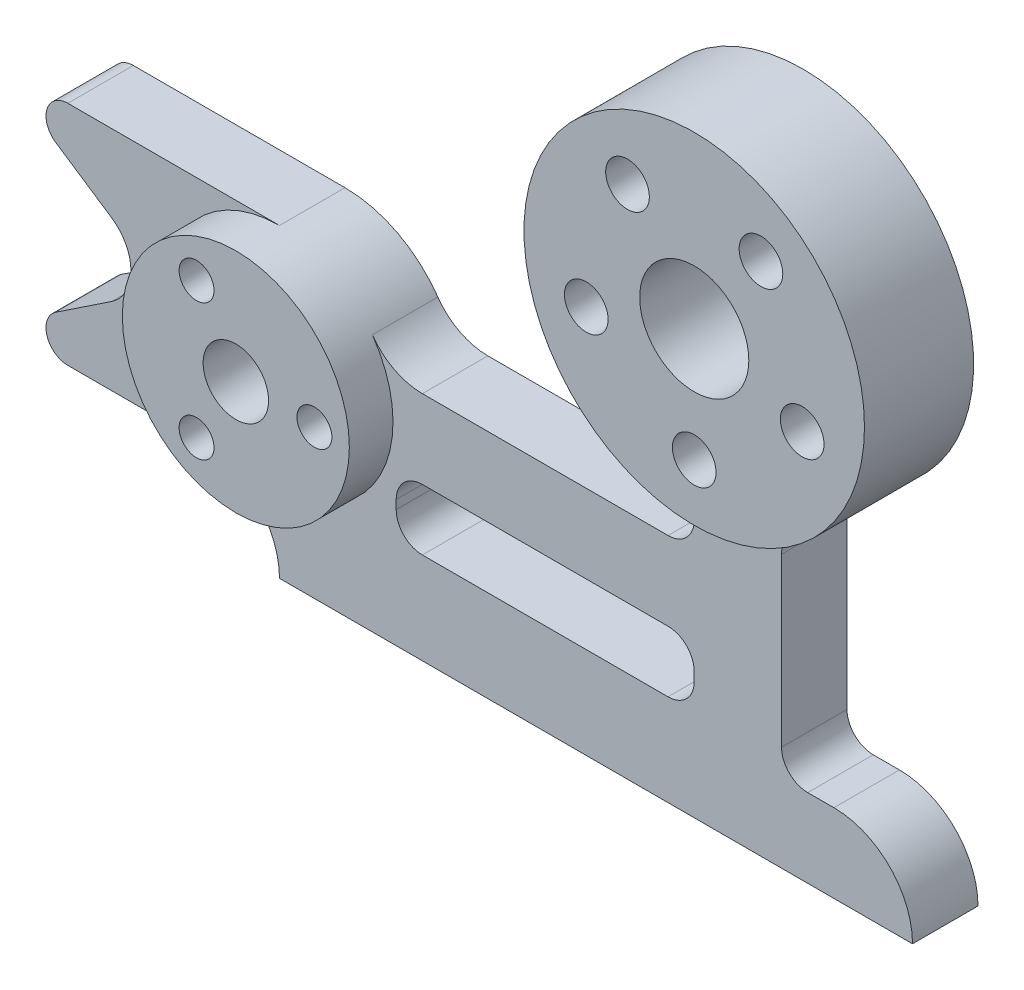
from build123d import *

# Parameters (mm, degrees)
EXTRUDE_1_DEPTH = 15
SKETCH_1_3_R    = 26
SKETCH_1_3_R_2  = 4
SKETCH_1_3_R_3  = 7.5
SKETCH_1_3_R_4  = 39
SKETCH_1_3_R_5  = 5
SKETCH_1_3_R_6  = 12.5
EXTRUDE_4_DEPTH = 25
EXTRUDE_5_DEPTH = 10


with BuildPart() as part:
    # Эскиз1 → Бобышка-Вытянуть1 (new body)
    with BuildSketch(Plane.XY):
        with BuildLine():
            Line((0, 26), (-48.486121811, 26))
            ThreePointArc((-48.486121811, 26), (-53.271581944, 22.448920743), (-51.259622792, 16.839748528))
            Line((-51.259622792, 16.839748528), (-38.480754415, 8.320502943))
            ThreePointArc((-38.480754415, 8.320502943), (-34.027756377, 0), (-38.480754415, -8.320502943))
            Line((-38.480754415, -8.320502943), (-51.259622792, -16.839748528))
            ThreePointArc((-51.259622792, -16.839748528), (-53.271581944, -22.448920743), (-48.486121811, -26))
            Line((-48.486121811, -26), (-18, -26))
            ThreePointArc((-18, -26), (-5.272077939, -31.272077939), (0, -44))
            Line((0, -44), (145, -44))
            ThreePointArc((145, -44), (139.727922061, -31.272077939), (127, -26))
            Line((127, -26), (121, -26))
            ThreePointArc((121, -26), (116.757359313, -24.242640687), (115, -20))
            Line((115, -20), (115, 18.267461507))
            ThreePointArc((115, 18.267461507), (116.609042768, 23.70729944), (120.918367347, 27.396550996))
            ThreePointArc((120.918367347, 27.396550996), (105, 24), (89.081632653, 27.396550996))
            ThreePointArc((89.081632653, 27.396550996), (93.390957232, 23.70729944), (95, 18.267461507))
            Line((95, 18.267461507), (95, 15))
            ThreePointArc((95, 15), (93.242640687, 10.757359313), (89, 9))
            Line((89, 9), (32.726136344, 9))
            ThreePointArc((32.726136344, 9), (26.272455224, 10.576232455), (21.271988624, 14.95))
            ThreePointArc((21.271988624, 14.95), (24.789833644, 7.839907391), (26, 0))
            ThreePointArc((26, 0), (-18.384776311, -18.384776311), (0, 26))
        make_face()
        with BuildLine():
            Line((89, -23), (32.726136344, -23))
            ThreePointArc((32.726136344, -23), (28.483495657, -21.242640687), (26.726136344, -17))
            Line((26.726136344, -17), (26.726136344, -15))
            ThreePointArc((26.726136344, -15), (28.483495657, -10.757359313), (32.726136344, -9))
            Line((32.726136344, -9), (89, -9))
            ThreePointArc((89, -9), (93.242640687, -10.757359313), (95, -15))
            Line((95, -15), (95, -17))
            ThreePointArc((95, -17), (93.242640687, -21.242640687), (89, -23))
        make_face(mode=Mode.SUBTRACT)
    extrude(amount=EXTRUDE_1_DEPTH)

    # Эскиз1<3> → Бобышка-Вытянуть4 (add)
    # profile 1 of 2: a face of its own
    with BuildSketch(Plane.XY):
        Circle(SKETCH_1_3_R)
        with Locations((-9, -15.588457268)):
            Circle(SKETCH_1_3_R_2, mode=Mode.SUBTRACT)
        with Locations((-9, 15.588457268)):
            Circle(SKETCH_1_3_R_2, mode=Mode.SUBTRACT)
        Circle(SKETCH_1_3_R_3, mode=Mode.SUBTRACT)
        with Locations((18, 0)):
            Circle(SKETCH_1_3_R_2, mode=Mode.SUBTRACT)
    # profile 2 of 2: a face of its own
    with BuildSketch(Plane.XY):
        with Locations((105, 63)):
            Circle(SKETCH_1_3_R_4)
        with Locations((80.272530576, 54.965558146)):
            Circle(SKETCH_1_3_R_5, mode=Mode.SUBTRACT)
        with Locations((105, 37)):
            Circle(SKETCH_1_3_R_5, mode=Mode.SUBTRACT)
        with Locations((105, 63)):
            Circle(SKETCH_1_3_R_6, mode=Mode.SUBTRACT)
        with Locations((129.727469424, 54.965558146)):
            Circle(SKETCH_1_3_R_5, mode=Mode.SUBTRACT)
        with Locations((89.71758344, 84.034441854)):
            Circle(SKETCH_1_3_R_5, mode=Mode.SUBTRACT)
        with Locations((120.28241656, 84.034441854)):
            Circle(SKETCH_1_3_R_5, mode=Mode.SUBTRACT)
    extrude(amount=EXTRUDE_4_DEPTH)

    # Эскиз1<4> → Бобышка-Вытянуть5 (add)
    with BuildSketch(Plane.XY):
        with BuildLine():
            Line((0, 26), (-48.486121811, 26))
            ThreePointArc((-48.486121811, 26), (-53.271581944, 22.448920743), (-51.259622792, 16.839748528))
            Line((-51.259622792, 16.839748528), (-38.480754415, 8.320502943))
            ThreePointArc((-38.480754415, 8.320502943), (-34.027756377, 0), (-38.480754415, -8.320502943))
            Line((-38.480754415, -8.320502943), (-51.259622792, -16.839748528))
            ThreePointArc((-51.259622792, -16.839748528), (-53.271581944, -22.448920743), (-48.486121811, -26))
            Line((-48.486121811, -26), (-18, -26))
            ThreePointArc((-18, -26), (-5.272077939, -31.272077939), (0, -44))
            Line((0, -44), (145, -44))
            ThreePointArc((145, -44), (139.727922061, -31.272077939), (127, -26))
            Line((127, -26), (121, -26))
            ThreePointArc((121, -26), (116.757359313, -24.242640687), (115, -20))
            Line((115, -20), (115, 18.267461507))
            ThreePointArc((115, 18.267461507), (116.609042768, 23.70729944), (120.918367347, 27.396550996))
            ThreePointArc((120.918367347, 27.396550996), (105, 24), (89.081632653, 27.396550996))
            ThreePointArc((89.081632653, 27.396550996), (93.390957232, 23.70729944), (95, 18.267461507))
            Line((95, 18.267461507), (95, 15))
            ThreePointArc((95, 15), (93.242640687, 10.757359313), (89, 9))
            Line((89, 9), (32.726136344, 9))
            ThreePointArc((32.726136344, 9), (26.272455224, 10.576232455), (21.271988624, 14.95))
            ThreePointArc((21.271988624, 14.95), (24.789833644, 7.839907391), (26, 0))
            ThreePointArc((26, 0), (-18.384776311, -18.384776311), (0, 26))
        make_face()
        with BuildLine():
            Line((89, -23), (32.726136344, -23))
            ThreePointArc((32.726136344, -23), (28.483495657, -21.242640687), (26.726136344, -17))
            Line((26.726136344, -17), (26.726136344, -15))
            ThreePointArc((26.726136344, -15), (28.483495657, -10.757359313), (32.726136344, -9))
            Line((32.726136344, -9), (89, -9))
            ThreePointArc((89, -9), (93.242640687, -10.757359313), (95, -15))
            Line((95, -15), (95, -17))
            ThreePointArc((95, -17), (93.242640687, -21.242640687), (89, -23))
        make_face(mode=Mode.SUBTRACT)
    extrude(amount=EXTRUDE_5_DEPTH)


solid = part.part
